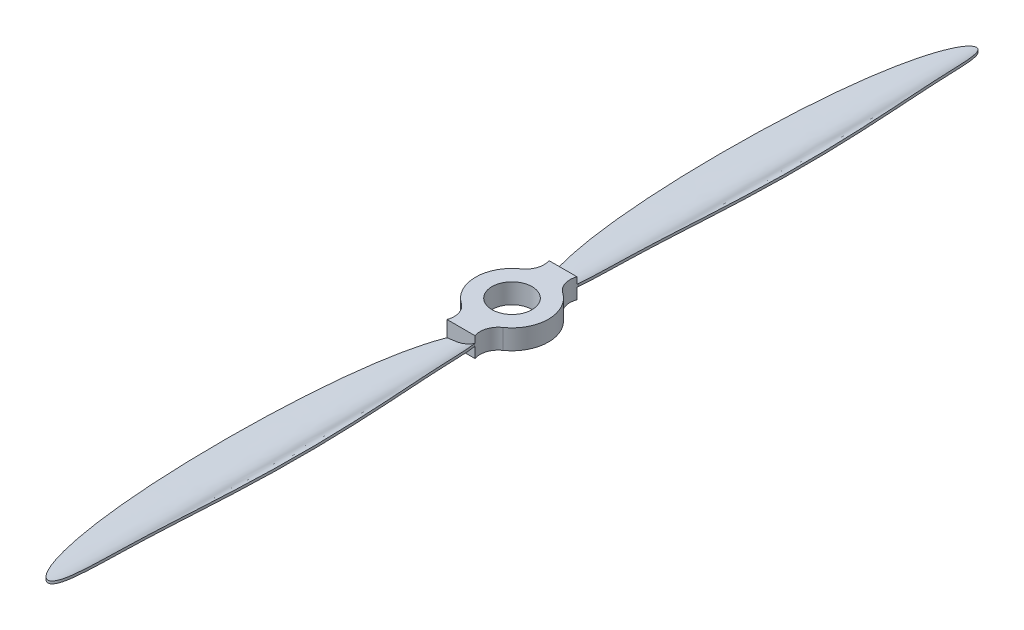
from build123d import *
from OCP.BRepAlgoAPI import BRepAlgoAPI_Cut
from OCP.TopTools import TopTools_ListOfShape

# Parameters (mm, degrees)
CROQUIS1_R              = 5.5
SALIENTE_EXTRUIR1_DEPTH = 8
CORTAR_EXTRUIR1_DEPTH   = 113
CORTAR_EXTRUIR2_DEPTH   = 113
SKETCH1_W               = 22.882291014
SKETCH1_H               = 32.116329262
CUT_EXTRUDE1_DEPTH      = 2.54


with BuildPart() as part:
    # Croquis1 → Saliente-Extruir1 (new body)
    with BuildSketch(Plane(origin=(0, 0, 0), x_dir=(1, 0, 0), z_dir=(0, 1, 0))):
        with BuildLine():
            ThreePointArc((-5.705045295, 8.21294455), (-10, 0), (-5.705045295, -8.21294455))
            ThreePointArc((-5.705045295, -8.21294455), (-3.744086953, -10.966493778), (-3.983349779, -14.338458231))
            add(Edge.make_bspline(
                [(-3.983349779, -14.338458231), (-16.746209804, -43.253222424), (-8.373104902, -104.032809261), (0, -164.812396098), (8.373104902, -104.032809261), (16.746209804, -43.253222424), (3.983349779, -14.338458231)],
                knots=[3.529141129, 3.529141129, 3.529141129, 5.365170581, 5.365170581, 7.201200033, 7.201200033, 9.037229485, 9.037229485, 9.037229485], degree=2, weights=[1, 0.607398449, 1, 0.607398449, 1, 0.607398449, 1]))
            ThreePointArc((3.983349779, -14.338458231), (3.744086953, -10.966493778), (5.705045295, -8.21294455))
            ThreePointArc((5.705045295, -8.21294455), (10, 0), (5.705045295, 8.21294455))
            ThreePointArc((5.705045295, 8.21294455), (3.744086953, 10.966493778), (3.983349779, 14.338458231))
            add(Edge.make_bspline(
                [(3.983349779, 14.338458231), (16.746209804, 43.253222424), (8.373104902, 104.032809261), (0, 164.812396098), (-8.373104902, 104.032809261), (-16.746209804, 43.253222424), (-3.983349779, 14.338458231)],
                knots=[3.529141129, 3.529141129, 3.529141129, 5.365170581, 5.365170581, 7.201200033, 7.201200033, 9.037229485, 9.037229485, 9.037229485], degree=2, weights=[1, 0.607398449, 1, 0.607398449, 1, 0.607398449, 1]))
            ThreePointArc((-3.983349779, 14.338458231), (-3.744086953, 10.966493778), (-5.705045295, 8.21294455))
        make_face()
        Circle(CROQUIS1_R, mode=Mode.SUBTRACT)
    extrude(amount=SALIENTE_EXTRUIR1_DEPTH)


with BuildPart() as cortar_extruir1_tool:
    # Croquis2 → Cortar-Extruir1 (new body)
    with BuildSketch(Plane.XY.offset(127)):
        with BuildLine():
            add(Edge.make_bspline(
                [(-10.540197636, 0), (-6.603539772, 0.46478874), (0.424988199, -0.221526612), (6.236212827, 4.945174416), (8.914111447, 7.197478074), (10.540197636, 7.3)],
                knots=[0, 0, 0, 0, 0.556269346, 0.795858616, 1, 1, 1, 1], degree=3))
            Line((-10.540197636, 0), (10.540197636, 0))
            Line((10.540197636, 0), (10.540197636, 7.3))
        make_face()
        with BuildLine():
            Line((-10.540197636, 8), (-10.540197636, 0.7))
            add(Edge.make_bspline(
                [(-10.540197636, 0.7), (-6.603539772, 1.16478874), (0.424988199, 0.478473388), (6.236212827, 5.645174416), (8.914111447, 7.897478074), (10.540197636, 8)],
                knots=[0, 0, 0, 0, 0.556269346, 0.795858616, 1, 1, 1, 1], degree=3))
            Line((10.540197636, 8), (-10.540197636, 8))
        make_face()
    extrude(amount=-CORTAR_EXTRUIR1_DEPTH)


with BuildPart() as part_1:
    add(part.part)

    # Cortar-Extruir1: cut by cortar_extruir1_tool, with a tolerance
    cortar_extruir1_stock = TopTools_ListOfShape()
    cortar_extruir1_stock.Append(part_1.part.wrapped)
    cortar_extruir1_tools = TopTools_ListOfShape()
    cortar_extruir1_tools.Append(cortar_extruir1_tool.part.wrapped)
    cortar_extruir1_cut = BRepAlgoAPI_Cut()
    cortar_extruir1_cut.SetArguments(cortar_extruir1_stock)
    cortar_extruir1_cut.SetTools(cortar_extruir1_tools)
    cortar_extruir1_cut.SetFuzzyValue(0.00001)
    cortar_extruir1_cut.Build()
    add(Compound.cast(cortar_extruir1_cut.Shape()).solids(), mode=Mode.REPLACE)


with BuildPart() as cortar_extruir2_tool:
    # Croquis3 → Cortar-Extruir2 (new body)
    with BuildSketch(Plane(origin=(0, 0, -127), x_dir=(-1, 0, 0), z_dir=(0, 0, -1))):
        with BuildLine():
            Line((-10.540197636, 7.3), (-10.540197636, 0))
            Line((-10.540197636, 0), (10.540197636, 0))
            add(Edge.make_bspline(
                [(10.540197636, 0), (6.603539772, 0.46478874), (-0.424988199, -0.221526612), (-6.236212827, 4.945174416), (-8.914111447, 7.197478074), (-10.540197636, 7.3)],
                knots=[0, 0, 0, 0, 0.556269346, 0.795858616, 1, 1, 1, 1], degree=3))
        make_face()
        with BuildLine():
            add(Edge.make_bspline(
                [(10.540197636, 0.7), (6.603539772, 1.16478874), (-0.424988199, 0.478473388), (-6.236212827, 5.645174416), (-8.914111447, 7.897478074), (-10.540197636, 8)],
                knots=[0, 0, 0, 0, 0.556269346, 0.795858616, 1, 1, 1, 1], degree=3))
            Line((10.540197636, 0.7), (10.540197636, 8))
            Line((10.540197636, 8), (-10.540197636, 8))
        make_face()
    extrude(amount=-CORTAR_EXTRUIR2_DEPTH)


with BuildPart() as part_2:
    add(part_1.part)

    # Cortar-Extruir2: cut by cortar_extruir2_tool, with a tolerance
    cortar_extruir2_stock = TopTools_ListOfShape()
    cortar_extruir2_stock.Append(part_2.part.wrapped)
    cortar_extruir2_tools = TopTools_ListOfShape()
    cortar_extruir2_tools.Append(cortar_extruir2_tool.part.wrapped)
    cortar_extruir2_cut = BRepAlgoAPI_Cut()
    cortar_extruir2_cut.SetArguments(cortar_extruir2_stock)
    cortar_extruir2_cut.SetTools(cortar_extruir2_tools)
    cortar_extruir2_cut.SetFuzzyValue(0.00001)
    cortar_extruir2_cut.Build()
    add(Compound.cast(cortar_extruir2_cut.Shape()).solids(), mode=Mode.REPLACE)

    # Sketch1 → Cut-Extrude1 (cut)
    with BuildSketch(Plane(origin=(0, 8, 0), x_dir=(1, 0, 0), z_dir=(0, 1, 0))):
        Rectangle(SKETCH1_W, SKETCH1_H)
    extrude(amount=-CUT_EXTRUDE1_DEPTH, mode=Mode.SUBTRACT)


solid = part_2.part
